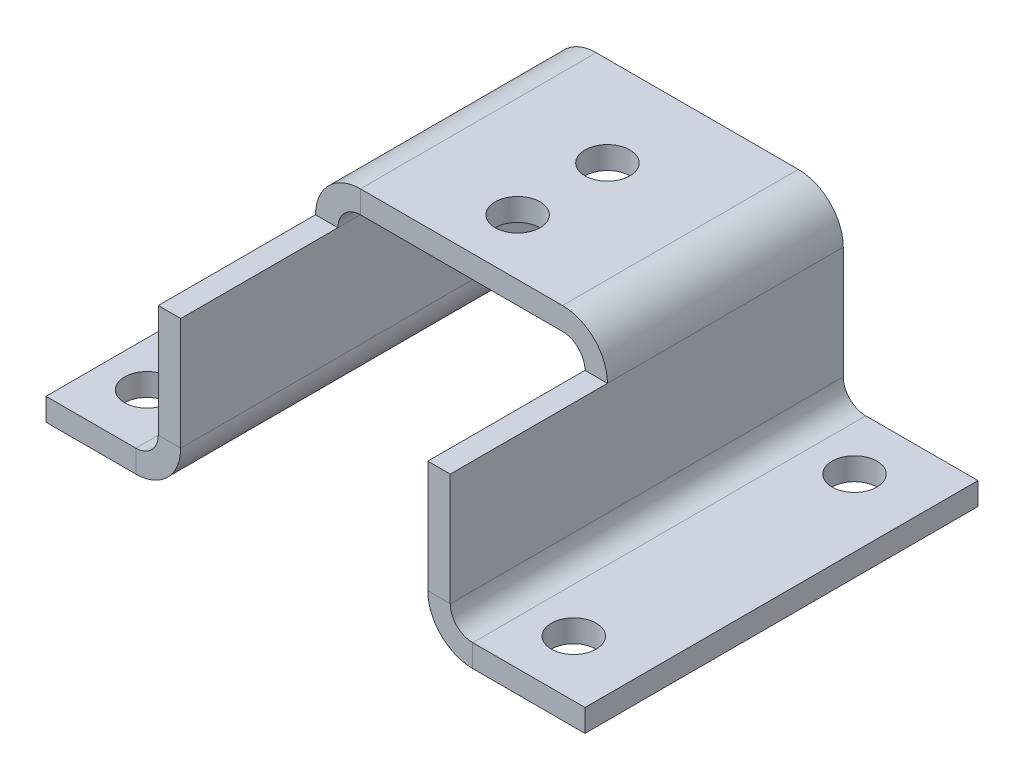
from build123d import *

# Parameters (mm, degrees)
SKETCH1_W                    = 12
SKETCH1_H                    = 35
BASE_FLANGE1_DEPTH           = 2
EDGE_FLANGE1_STRIP_W         = 12
EDGE_FLANGE1_STRIP_H         = 2
EDGE_FLANGE1_STRIP_CUT_DEPTH = 35
EDGE_FLANGE1_DEPTH           = 35
EDGE_FLANGE2_STRIP_W         = 12
EDGE_FLANGE2_STRIP_H         = 2
EDGE_FLANGE2_STRIP_CUT_DEPTH = 35
EDGE_FLANGE2_DEPTH           = 35
EDGE_FLANGE3_STRIP_W         = 12
EDGE_FLANGE3_STRIP_H         = 2
EDGE_FLANGE3_STRIP_CUT_DEPTH = 35
EDGE_FLANGE3_DEPTH           = 35
EDGE_FLANGE4_STRIP_W         = 12
EDGE_FLANGE4_STRIP_H         = 2
EDGE_FLANGE4_STRIP_CUT_DEPTH = 35
EDGE_FLANGE4_DEPTH           = 35
SKETCH18_W                   = 30
SKETCH18_H                   = 14
CUT_EXTRUDE1_DEPTH           = 4
SKETCH19_R                   = 2
CUT_EXTRUDE2_DEPTH           = 49.231213959
SKETCH20_R                   = 2
CUT_EXTRUDE4_DEPTH           = 49.931073971


# Sheet-metal steps are written as plain solids
with BuildPart() as part:
    # Sketch1 → Base-Flange1 (new body)
    with BuildSketch(Plane(origin=(0, 0, 0), x_dir=(1, 0, 0), z_dir=(0, 1, 0))):
        Rectangle(SKETCH1_W, SKETCH1_H)
    extrude(amount=-BASE_FLANGE1_DEPTH)

    # Edge-Flange1 strip (across the edge) → Edge-Flange1 strip cut (cut)
    with BuildSketch(Plane(origin=(6, 0, 17.5), x_dir=(-1, 0, 0), z_dir=(0, 0, -1))):
        with Locations((-2, -1)):
            Rectangle(EDGE_FLANGE1_STRIP_W, EDGE_FLANGE1_STRIP_H)
    extrude(amount=EDGE_FLANGE1_STRIP_CUT_DEPTH, mode=Mode.SUBTRACT)

    # Edge-Flange1 section (across the edge) → Edge-Flange1 (add)
    with BuildSketch(Plane(origin=(6, 0, 17.5), x_dir=(-1, 0, 0), z_dir=(0, 0, -1))):
        with BuildLine():
            Line((0, 2), (0, 16))
            Line((0, 16), (2, 16))
            Line((2, 16), (2, 2))
            ThreePointArc((2, 2), (2.585786438, 0.585786438), (4, 0))
            Line((4, 0), (4, -2))
            ThreePointArc((4, -2), (1.171572875, -0.828427125), (0, 2))
        make_face()
    extrude(amount=EDGE_FLANGE1_DEPTH)

    # Edge-Flange2 strip (across the edge) → Edge-Flange2 strip cut (cut)
    with BuildSketch(Plane(origin=(6, 16, -17.5), x_dir=(0, -1, 0), z_dir=(0, 0, 1))):
        with Locations((-2, -1)):
            Rectangle(EDGE_FLANGE2_STRIP_W, EDGE_FLANGE2_STRIP_H)
    extrude(amount=EDGE_FLANGE2_STRIP_CUT_DEPTH, mode=Mode.SUBTRACT)

    # Edge-Flange2 section (across the edge) → Edge-Flange2 (add)
    with BuildSketch(Plane(origin=(6, 16, -17.5), x_dir=(0, -1, 0), z_dir=(0, 0, 1))):
        with BuildLine():
            Line((0, 2), (0, 24))
            Line((0, 24), (2, 24))
            Line((2, 24), (2, 2))
            ThreePointArc((2, 2), (2.585786438, 0.585786438), (4, 0))
            Line((4, 0), (4, -2))
            ThreePointArc((4, -2), (1.171572875, -0.828427125), (0, 2))
        make_face()
    extrude(amount=EDGE_FLANGE2_DEPTH)

    # Edge-Flange3 strip (across the edge) → Edge-Flange3 strip cut (cut)
    with BuildSketch(Plane(origin=(30, 14, -17.5), x_dir=(-1, 0, 0), z_dir=(0, 0, 1))):
        with Locations((-2, -1)):
            Rectangle(EDGE_FLANGE3_STRIP_W, EDGE_FLANGE3_STRIP_H)
    extrude(amount=EDGE_FLANGE3_STRIP_CUT_DEPTH, mode=Mode.SUBTRACT)

    # Edge-Flange3 section (across the edge) → Edge-Flange3 (add)
    with BuildSketch(Plane(origin=(30, 14, -17.5), x_dir=(-1, 0, 0), z_dir=(0, 0, 1))):
        with BuildLine():
            Line((0, 2), (0, 16))
            Line((0, 16), (2, 16))
            Line((2, 16), (2, 2))
            ThreePointArc((2, 2), (2.585786438, 0.585786438), (4, 0))
            Line((4, 0), (4, -2))
            ThreePointArc((4, -2), (1.171572875, -0.828427125), (0, 2))
        make_face()
    extrude(amount=EDGE_FLANGE3_DEPTH)

    # Edge-Flange4 strip (across the edge) → Edge-Flange4 strip cut (cut)
    with BuildSketch(Plane(origin=(30, -2, 17.5), x_dir=(0, 1, 0), z_dir=(0, 0, -1))):
        with Locations((-2, -1)):
            Rectangle(EDGE_FLANGE4_STRIP_W, EDGE_FLANGE4_STRIP_H)
    extrude(amount=EDGE_FLANGE4_STRIP_CUT_DEPTH, mode=Mode.SUBTRACT)

    # Edge-Flange4 section (across the edge) → Edge-Flange4 (add)
    with BuildSketch(Plane(origin=(30, -2, 17.5), x_dir=(0, 1, 0), z_dir=(0, 0, -1))):
        with BuildLine():
            Line((0, 2), (0, 12))
            Line((0, 12), (2, 12))
            Line((2, 12), (2, 2))
            ThreePointArc((2, 2), (2.585786438, 0.585786438), (4, 0))
            Line((4, 0), (4, -2))
            ThreePointArc((4, -2), (1.171572875, -0.828427125), (0, 2))
        make_face()
    extrude(amount=EDGE_FLANGE4_DEPTH)

    # Sketch18 → Cut-Extrude1 (cut)
    with BuildSketch(Plane(origin=(0, 16, 0), x_dir=(1, 0, 0), z_dir=(0, 1, 0))):
        with Locations((17, -10.5)):
            Rectangle(SKETCH18_W, SKETCH18_H)
    extrude(amount=-CUT_EXTRUDE1_DEPTH, mode=Mode.SUBTRACT)

    # Sketch19 → Cut-Extrude2 (cut, through all)
    with BuildSketch(Plane(origin=(0, 0, 0), x_dir=(1, 0, 0), z_dir=(0, 1, 0))):
        with Locations(Location((-2, 12.5, 0), (0, 0, 270))):
            Circle(SKETCH19_R)
        with Locations(Location((-2, -12.5, 0), (0, 0, 270))):
            Circle(SKETCH19_R)
        with Locations(Location((36, 12.5, 0), (0, 0, 270))):
            Circle(SKETCH19_R)
        with Locations(Location((36, -12.5, 0), (0, 0, 270))):
            Circle(SKETCH19_R)
    extrude(amount=-CUT_EXTRUDE2_DEPTH, mode=Mode.SUBTRACT)

    # Sketch20 → Cut-Extrude4 (cut, through all)
    with BuildSketch(Plane(origin=(0, 16, 0), x_dir=(1, 0, 0), z_dir=(0, 1, 0))):
        with Locations(Location((17, 9.5, 0), (0, 0, 270))):
            Circle(SKETCH20_R)
        with Locations(Location((17, 1.5, 0), (0, 0, 270))):
            Circle(SKETCH20_R)
    extrude(amount=-CUT_EXTRUDE4_DEPTH, mode=Mode.SUBTRACT)


solid = part.part
